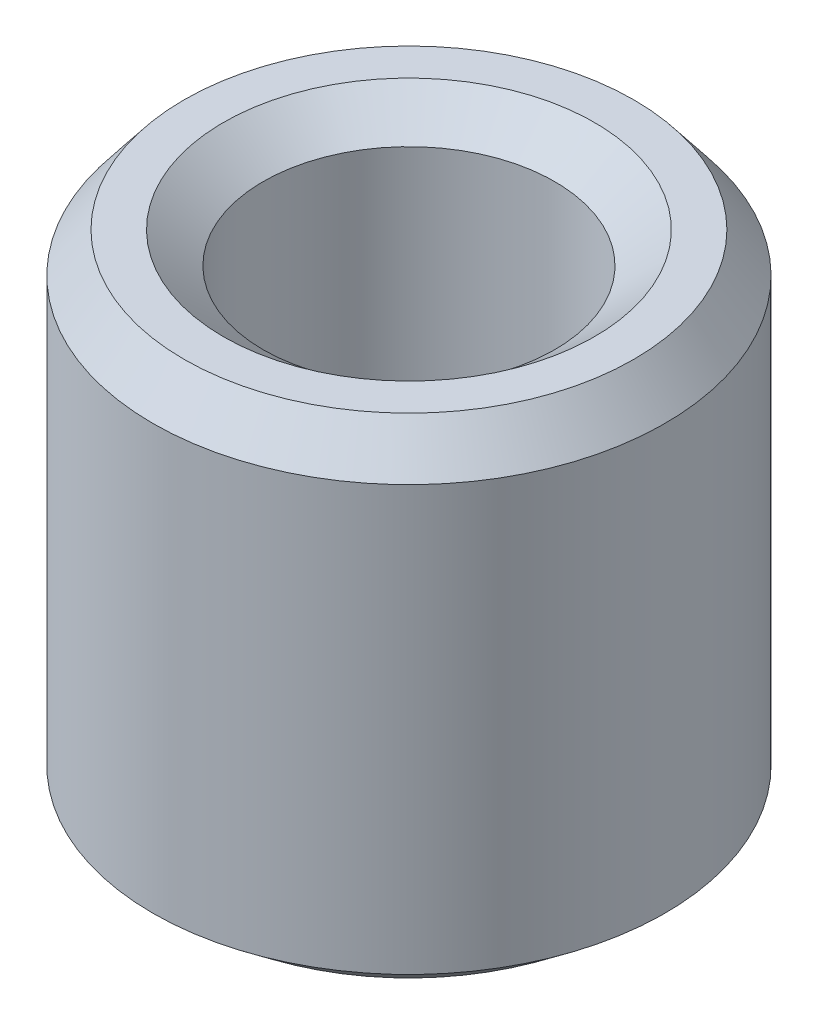
from build123d import *
from OCP.BRepFilletAPI import BRepFilletAPI_MakeChamfer

# Parameters (mm, degrees)
SKETCH1_R           = 10
BOSS_EXTRUDE1_DEPTH = 19.341662346
SKETCH2_R           = 5.691092601
CUT_EXTRUDE1_DEPTH  = 24.960381932
CHAMFER1_SIZE       = 1.556144745
CHAMFER1_SIZE2      = 1.219564955


with BuildPart() as part:
    # Sketch1 → Boss-Extrude1 (new body)
    with BuildSketch(Plane(origin=(0, 0, 0), x_dir=(1, 0, 0), z_dir=(0, 1, 0))):
        Circle(SKETCH1_R)
    extrude(amount=BOSS_EXTRUDE1_DEPTH)

    # Sketch2 → Cut-Extrude1 (cut, through all)
    with BuildSketch(Plane(origin=(0, 0, 0), x_dir=(1, 0, 0), z_dir=(0, 1, 0))):
        Circle(SKETCH2_R)
    extrude(amount=CUT_EXTRUDE1_DEPTH, mode=Mode.SUBTRACT)

    # Chamfer1: one chamfer whose edges measure the first distance from different faces: ONE call of the kernel's chamfer builder (chamfer() names one face for all edges)
    chamfer1_edges_1 = [part.edges().sort_by_distance(p)[0] for p in [
        (-5.691092601, 19.341662346, 0),
    ]]
    chamfer1_side_1 = [part.faces().sort_by_distance(p)[0] for p in [
        (-9.717157288, 19.341662346, 0),
    ]]
    chamfer1_edges_2 = [part.edges().sort_by_distance(p)[0] for p in [
        (-5.691092601, 0, 0),
    ]]
    chamfer1_side_2 = [part.faces().sort_by_distance(p)[0] for p in [
        (-5.691092601, 9.670831173, 0),
    ]]
    chamfer1_edges_3 = [part.edges().sort_by_distance(p)[0] for p in [
        (-10, 0, 0),
    ]]
    chamfer1_side_3 = [part.faces().sort_by_distance(p)[0] for p in [
        (-9.717157288, 0, 0),
    ]]
    chamfer1_edges_4 = [part.edges().sort_by_distance(p)[0] for p in [
        (-10, 19.341662346, 0),
    ]]
    chamfer1_side_4 = [part.faces().sort_by_distance(p)[0] for p in [
        (-10, 9.670831173, 0),
    ]]
    chamfer1 = BRepFilletAPI_MakeChamfer(part.part.solid().wrapped)
    for e in chamfer1_edges_1:
        chamfer1.Add(CHAMFER1_SIZE, CHAMFER1_SIZE2, e.wrapped, chamfer1_side_1[0].wrapped)  # the first distance lies on this face
    for e in chamfer1_edges_2:
        chamfer1.Add(CHAMFER1_SIZE, CHAMFER1_SIZE2, e.wrapped, chamfer1_side_2[0].wrapped)  # the first distance lies on this face
    for e in chamfer1_edges_3:
        chamfer1.Add(CHAMFER1_SIZE, CHAMFER1_SIZE2, e.wrapped, chamfer1_side_3[0].wrapped)  # the first distance lies on this face
    for e in chamfer1_edges_4:
        chamfer1.Add(CHAMFER1_SIZE, CHAMFER1_SIZE2, e.wrapped, chamfer1_side_4[0].wrapped)  # the first distance lies on this face
    add(Compound.cast(chamfer1.Shape()), mode=Mode.REPLACE)


solid = part.part
